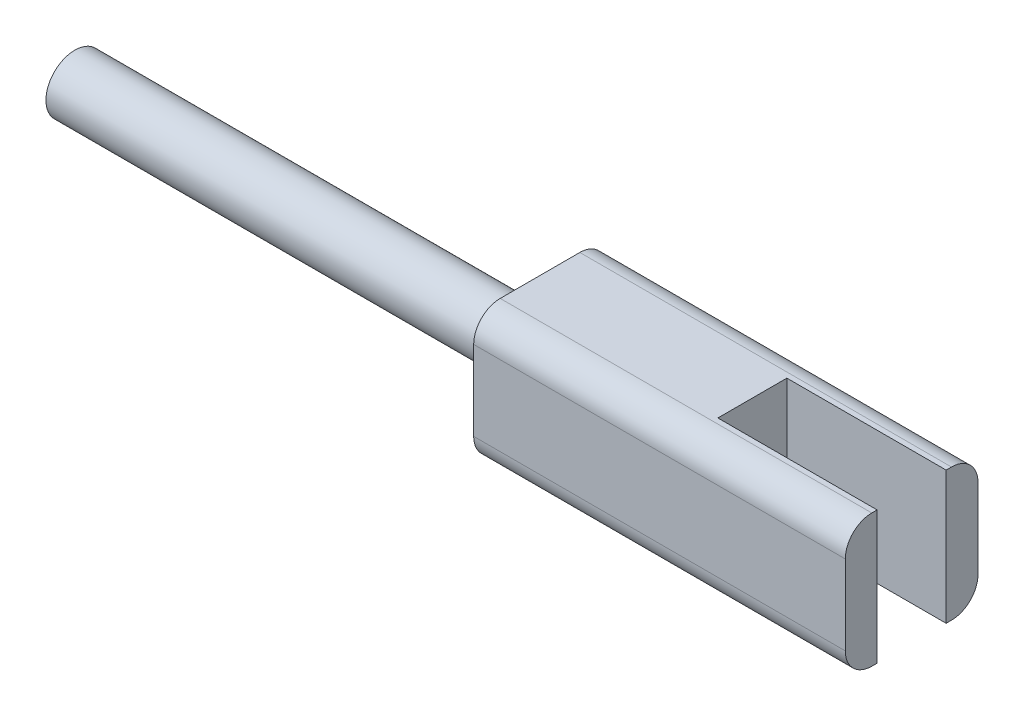
from build123d import *

# Parameters (mm, degrees)
SKETCH1_R               = 1.09
BOSS_EXTRUDE1_DEPTH     = 19.524
BOSS_EXTRUDE2_DEPTH     = 14
CUT_EXTRUDE1_DEPTH      = 32.721642076
CUT_EXTRUDE1_DEPTH_BACK = 32.721642076
SKETCH3_W               = 7
SKETCH3_H               = 2.6


with BuildPart() as part:
    # Sketch1 → Boss-Extrude1 (new body)
    with BuildSketch(Plane(origin=(0, 0, 0), x_dir=(0, 0, -1), z_dir=(1, 0, 0))):
        Circle(SKETCH1_R)
    extrude(amount=BOSS_EXTRUDE1_DEPTH)

    # Sketch2 → Boss-Extrude2 (add)
    with BuildSketch(Plane(origin=(17.524, 0, 0), x_dir=(0, 0, -1), z_dir=(1, 0, 0))):
        with BuildLine():
            Line((-1.5, -2.5), (1.5, -2.5))
            ThreePointArc((1.5, -2.5), (2.207106781, -2.207106781), (2.5, -1.5))
            Line((2.5, -1.5), (2.5, 1.5))
            ThreePointArc((2.5, 1.5), (2.207106781, 2.207106781), (1.5, 2.5))
            Line((1.5, 2.5), (-1.5, 2.5))
            ThreePointArc((-1.5, 2.5), (-2.207106781, 2.207106781), (-2.5, 1.5))
            Line((-2.5, 1.5), (-2.5, -1.5))
            ThreePointArc((-2.5, -1.5), (-2.207106781, -2.207106781), (-1.5, -2.5))
        make_face()
    extrude(amount=BOSS_EXTRUDE2_DEPTH)

    # Sketch3 → Cut-Extrude1 (cut, two sides: drawn at the far end of the back side and taken through both)
    with BuildSketch(Plane(origin=(0, 0, 0), x_dir=(1, 0, 0), z_dir=(0, 1, 0)).offset(-CUT_EXTRUDE1_DEPTH_BACK)):
        with Locations((29.024, 0)):
            Rectangle(SKETCH3_W, SKETCH3_H)
    extrude(amount=CUT_EXTRUDE1_DEPTH + CUT_EXTRUDE1_DEPTH_BACK, mode=Mode.SUBTRACT)


solid = part.part
